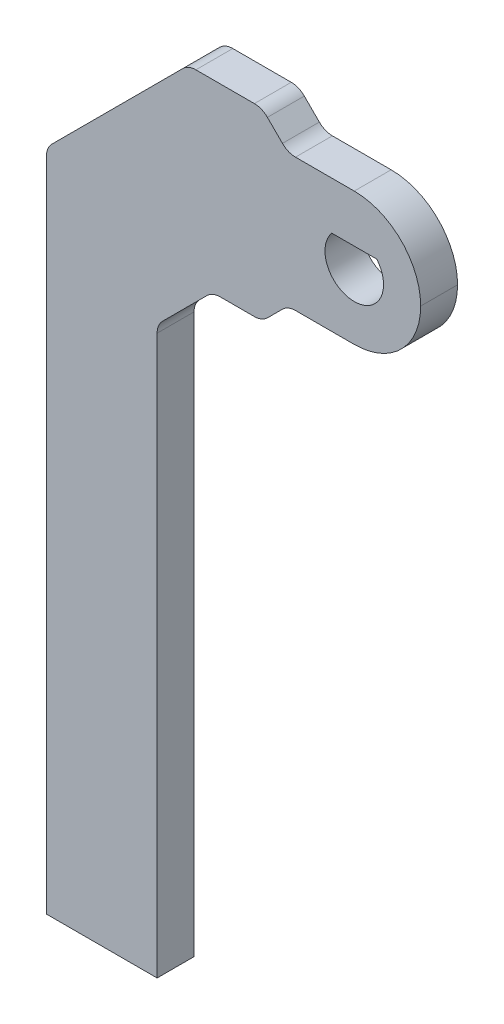
from build123d import *

# Parameters (mm, degrees)
ESQUISSE2_R        = 3.96875
BOSS_EXTRU_6_DEPTH = 5
BOSS_EXTRU_7_DEPTH = 5
CONG_1_R           = 9
CONG_2_R           = 2.5


with BuildPart() as part:
    # Esquisse2 → Boss.-Extru.6 (new body)
    with BuildSketch(Plane.XY):
        Polygon((0, 0), (0, 90), (19.215728753, 109.215728753), (29.215728753, 109.215728753), (32.715728753, 105.715728753), (50.715728753, 105.715728753), (50.715728753, 87.715728753), (32.715728753, 87.715728753), (29.215728753, 84.215728753), (22.5, 84.215728753), (15, 76.715728753), (15, 0), align=None)
        with Locations((41.715728753, 96.715728753)):
            Circle(ESQUISSE2_R, mode=Mode.SUBTRACT)
    extrude(amount=BOSS_EXTRU_6_DEPTH)

    # Esquisse3 → Boss.-Extru.7 (add, through all)
    with BuildSketch(Plane.XY.offset(5)):
        with BuildLine():
            Line((38.666240834, 99.255728753), (44.765216671, 99.255728753))
            ThreePointArc((44.765216671, 99.255728753), (41.715728753, 100.684478753), (38.666240834, 99.255728753))
        make_face()
    extrude(amount=-BOSS_EXTRU_7_DEPTH)

    # Congé1
    cong_1_edges = [part.edges().sort_by_distance(p)[0] for p in [
        (50.715728753, 87.715728753, 2.5),
        (50.715728753, 105.715728753, 2.5),
    ]]
    fillet(cong_1_edges, radius=CONG_1_R - 0.0001)  # a hair under: the kernel refuses the full size

    # Congé2
    cong_2_edges = [part.edges().sort_by_distance(p)[0] for p in [
        (0, 90, 2.5),
        (19.215728753, 109.215728753, 2.5),
        (29.215728753, 109.215728753, 2.5),
        (32.715728753, 105.715728753, 2.5),
        (32.715728753, 87.715728753, 2.5),
        (29.215728753, 84.215728753, 2.5),
        (22.5, 84.215728753, 2.5),
        (15, 76.715728753, 2.5),
    ]]
    fillet(cong_2_edges, radius=CONG_2_R)


solid = part.part
